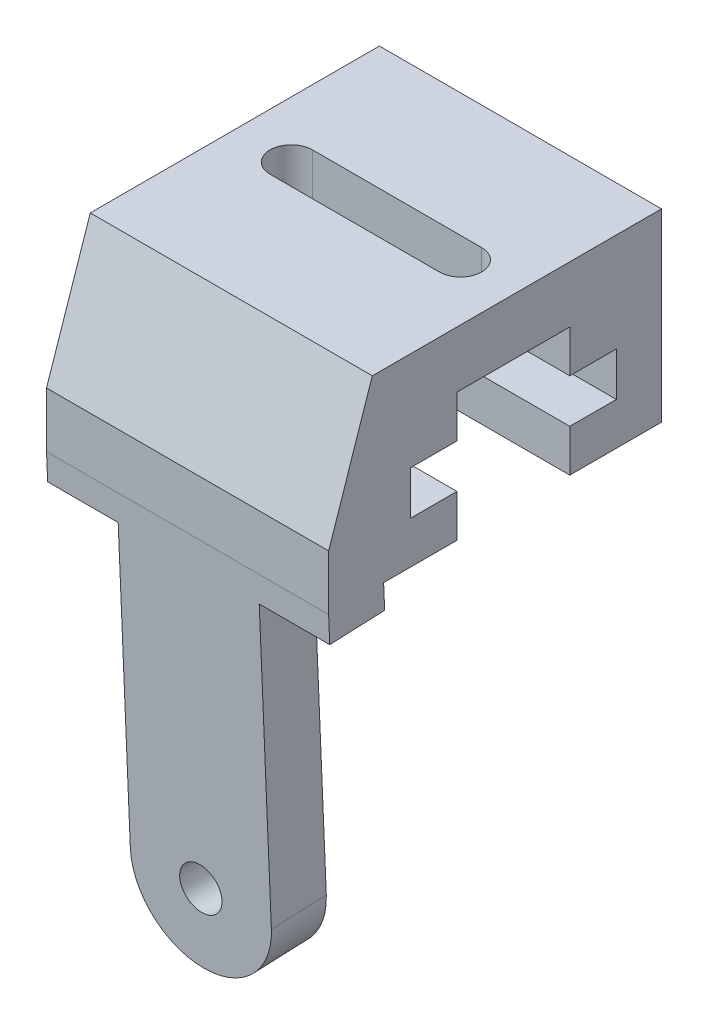
from build123d import *

# Parameters (mm, degrees)
SALIENTE_EXTRUIR1_DEPTH = 10
SALIENTE_EXTRUIR2_DEPTH = 5
REDONDEO1_R             = 5
CORTAR_EXTRUIR2_REACH   = 48.394
CROQUIS4_R              = 1.5
CORTAR_EXTRUIR3_DEPTH   = 5


with BuildPart() as part:
    # Croquis1 → Saliente-Extruir1 (new, symmetric)
    with BuildSketch(Plane(origin=(0, 0, 0), x_dir=(0, 0, -1), z_dir=(1, 0, 0))):
        Polygon((20.5, 0), (0, 0), (-3.1, -9.2), (-3.1, -13.1), (-3.019721522, -15), (0.873328538, -14.835511509), (0.8, -13.1), (6, -13.1), (6, -10.1), (2.7, -10.1), (2.7, -7), (6, -7), (6, -4), (14, -4), (14, -7), (17.3, -7), (17.3, -10.1), (14, -10.1), (14, -13.1), (20.5, -13.1), align=None)
    extrude(amount=SALIENTE_EXTRUIR1_DEPTH, both=True)

    # Croquis1<4> → Saliente-Extruir2 (add, symmetric)
    with BuildSketch(Plane(origin=(0, 0, 0), x_dir=(0, 0, -1), z_dir=(1, 0, 0))):
        Polygon((0.873328538, -14.835511509), (-3.019721522, -15), (-1.94652503, -40.4), (1.94652503, -40.235511509), align=None)
    extrude(amount=SALIENTE_EXTRUIR2_DEPTH, both=True)

    # Redondeo1
    redondeo1_edges = [part.edges().sort_by_distance(p)[0] for p in [
        (-5, -40.317755755, 0),
        (5, -40.317755755, 0),
    ]]
    fillet(redondeo1_edges, radius=REDONDEO1_R - 0.0001)  # a hair under: the kernel refuses the full size

    # Croquis3 → Cortar-Extruir2 (cut, up to next)
    with BuildSketch(Plane(origin=(0, 0, 0), x_dir=(1, 0, 0), z_dir=(0, 1, 0)), mode=Mode.PRIVATE) as cortar_extruir2_sk1:
        with BuildLine():
            Line((-6, 11.75), (6, 11.75))
            ThreePointArc((6, 11.75), (7.5, 10.25), (6, 8.75))
            Line((6, 8.75), (-6, 8.75))
            ThreePointArc((-6, 8.75), (-7.5, 10.25), (-6, 11.75))
        make_face()
    cortar_extruir2_tool1 = extrude(cortar_extruir2_sk1.sketch, amount=-CORTAR_EXTRUIR2_REACH, mode=Mode.PRIVATE) & part.part
    add(cortar_extruir2_tool1.solids().sort_by_distance((0, 0, -10.25))[0], mode=Mode.SUBTRACT)

    # Croquis4 → Cortar-Extruir3 (cut, symmetric)
    with BuildSketch(Plane.XY):
        with Locations(Location((0, -35.404457076, 0), (0, 0, 270))):
            Circle(CROQUIS4_R)
    extrude(amount=CORTAR_EXTRUIR3_DEPTH, both=True, mode=Mode.SUBTRACT)


solid = part.part
